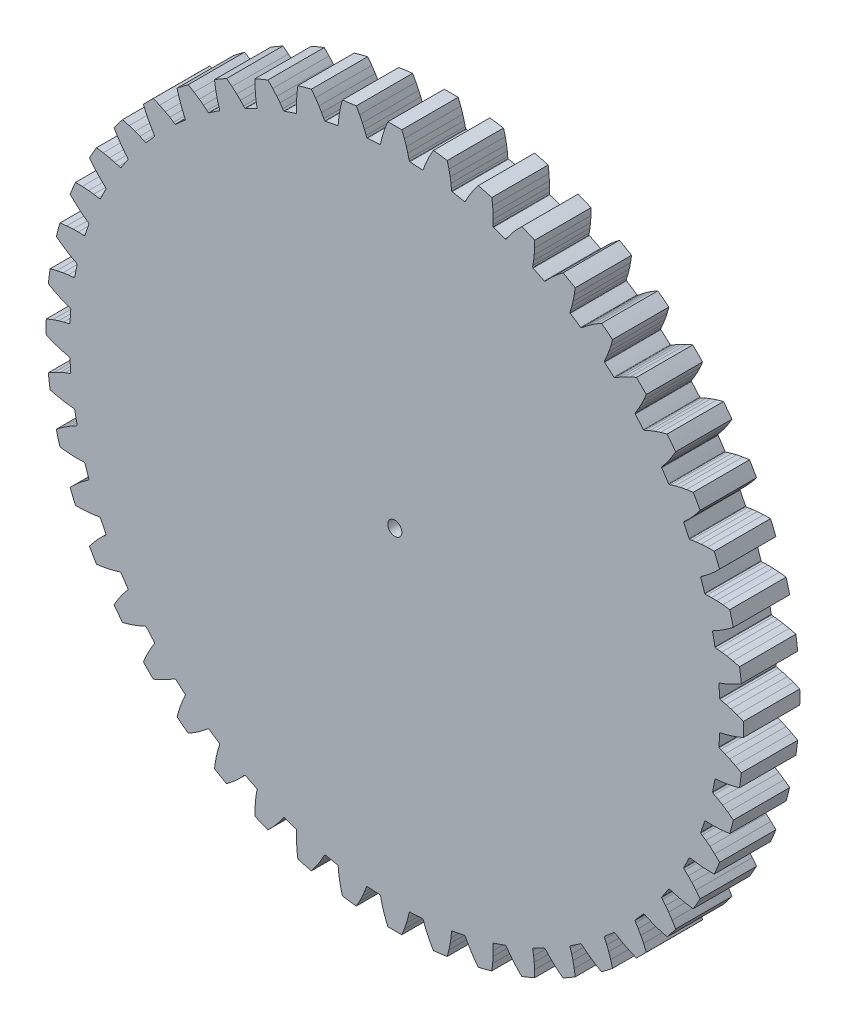
from build123d import *

# Parameters (mm, degrees)
BOSS_EXTRUDE1_DEPTH = 12.7
SKETCH2_R           = 1.5875
CUT_EXTRUDE1_DEPTH  = 112.886408538


with BuildPart() as part:
    # Model → Boss-Extrude1 (new body)
    with BuildSketch(Plane.XY):
        with BuildLine():
            ThreePointArc((73.162446932, -4.79532012), (73.204630323, -4.10132118), (73.240230779, -3.406953428))
            ThreePointArc((73.240230779, -3.406953428), (73.260031427, -3.342420246), (73.308462453, -3.295398625))
            ThreePointArc((73.308462453, -3.295398625), (73.487533932, -3.211262438), (73.677741354, -3.156795666))
            ThreePointArc((73.677741354, -3.156795666), (74.184998964, -3.047419574), (74.689081629, -2.92423646))
            ThreePointArc((74.689081629, -2.92423646), (75.251182782, -2.771398985), (75.809400918, -2.604937236))
            ThreePointArc((75.809400918, -2.604937236), (76.484121563, -2.384761597), (77.152671556, -2.14650508))
            ThreePointArc((77.152671556, -2.14650508), (77.874182007, -1.868186231), (78.588597242, -1.572129509))
            ThreePointArc((78.588597242, -1.572129509), (78.604320541, 0), (78.588597242, 1.572129509))
            ThreePointArc((78.588597242, 1.572129509), (77.874182033, 1.868186221), (77.152671609, 2.14650506))
            ThreePointArc((77.152671609, 2.14650506), (76.484121638, 2.384761571), (75.809401016, 2.604937206))
            ThreePointArc((75.809401016, 2.604937206), (75.251182893, 2.771398953), (74.689081753, 2.924236429))
            ThreePointArc((74.689081753, 2.924236429), (74.184999097, 3.047419543), (73.677741495, 3.156795638))
            ThreePointArc((73.677741495, 3.156795638), (73.48753402, 3.211262408), (73.308462484, 3.295398596))
            ThreePointArc((73.308462484, 3.295398596), (73.260031444, 3.342420218), (73.24023078, 3.406953405))
            ThreePointArc((73.24023078, 3.406953405), (73.162446933, 4.795320109), (73.058347109, 6.181961972))
            ThreePointArc((73.058347109, 6.181961972), (73.06955509, 6.248527566), (73.111434229, 6.301468429))
            ThreePointArc((73.111434229, 6.301468429), (73.277991751, 6.408258337), (73.459462581, 6.487086188))
            ThreePointArc((73.459462581, 6.487086188), (73.948104087, 6.661736958), (74.431795632, 6.849662213))
            ThreePointArc((74.431795632, 6.849662213), (74.969138639, 7.074561066), (75.500853523, 7.312460799))
            ThreePointArc((75.500853523, 7.312460799), (76.141063151, 7.618821522), (76.77279489, 7.942303006))
            ThreePointArc((76.77279489, 7.942303006), (77.451804819, 8.312416811), (78.121464977, 8.699190627))
            ThreePointArc((78.121464977, 8.699190627), (77.931849682, 10.259922652), (77.71105682, 11.816550073))
            ThreePointArc((77.71105682, 11.816550073), (76.964110376, 12.016824081), (76.212444676, 12.198585857))
            ThreePointArc((76.212444676, 12.198585857), (75.518515528, 12.347540768), (74.820828547, 12.477764056))
            ThreePointArc((74.820828547, 12.477764056), (74.245658439, 12.569939614), (73.668416858, 12.648100622))
            ThreePointArc((73.668416858, 12.648100622), (73.152568076, 12.704433898), (72.635373689, 12.746663862))
            ThreePointArc((72.635373689, 12.746663862), (72.439684125, 12.775837604), (72.251162595, 12.83588047))
            ThreePointArc((72.251162595, 12.83588047), (72.197008335, 12.876178295), (72.168953797, 12.937574888))
            ThreePointArc((72.168953797, 12.937574888), (71.910617183, 14.303911092), (71.626414865, 15.665102288))
            ThreePointArc((71.626414865, 15.665102288), (71.628838407, 15.73256134), (71.663449094, 15.790515611))
            ThreePointArc((71.663449094, 15.790515611), (71.814642814, 15.918132035), (71.984272037, 16.0199722))
            ThreePointArc((71.984272037, 16.0199722), (72.445936647, 16.256909323), (72.900960975, 16.506361267))
            ThreePointArc((72.900960975, 16.506361267), (73.404351747, 16.799473416), (73.900465591, 17.104740603))
            ThreePointArc((73.900465591, 17.104740603), (74.495210038, 17.492044493), (75.079314418, 17.895216086))
            ThreePointArc((75.079314418, 17.895216086), (75.704205778, 18.350792096), (76.317652787, 18.821665199))
            ThreePointArc((76.317652787, 18.821665199), (75.925943269, 20.344295183), (75.50385867, 21.858786189))
            ThreePointArc((75.50385867, 21.858786189), (74.737161453, 21.959850751), (73.968201684, 22.041945467))
            ThreePointArc((73.968201684, 22.041945467), (73.260766679, 22.099050119), (72.552050957, 22.137092904))
            ThreePointArc((72.552050957, 22.137092904), (71.969770185, 22.153405123), (71.387264927, 22.155552307))
            ThreePointArc((71.387264927, 22.155552307), (70.868476334, 22.144071867), (70.350194501, 22.118433134))
            ThreePointArc((70.350194501, 22.118433134), (70.15237115, 22.121814677), (69.957625281, 22.15673687))
            ThreePointArc((69.957625281, 22.15673687), (69.898674397, 22.189621393), (69.862846006, 22.246830877))
            ThreePointArc((69.862846006, 22.246830877), (69.428376836, 23.567758191), (68.968934805, 24.880208361))
            ThreePointArc((68.968934805, 24.880208361), (68.962532439, 24.947406627), (68.989282477, 25.009382692))
            ThreePointArc((68.989282477, 25.009382692), (69.122525427, 25.155642081), (69.27741064, 25.278752046))
            ThreePointArc((69.27741064, 25.278752046), (69.704199144, 25.573921462), (70.122770665, 25.880631904))
            ThreePointArc((70.122770665, 25.880631904), (70.583596046, 26.236942118), (71.035620203, 26.604353553))
            ThreePointArc((71.035620203, 26.604353553), (71.574723228, 27.065973732), (72.101206061, 27.541937057))
            ThreePointArc((72.101206061, 27.541937057), (72.661286786, 28.075180241), (73.208024398, 28.622095861))
            ThreePointArc((73.208024398, 28.622095861), (72.620922915, 30.080571183), (72.004768564, 31.527012414))
            ThreePointArc((72.004768564, 31.527012414), (71.231438976, 31.527138285), (70.458342254, 31.508161279))
            ThreePointArc((70.458342254, 31.508161279), (69.7495058, 31.472438595), (69.04188766, 31.417649954))
            ThreePointArc((69.04188766, 31.417649954), (68.462459208, 31.357819728), (67.8846571, 31.28391635))
            ThreePointArc((67.8846571, 31.28391635), (67.371805314, 31.204818627), (66.861303979, 31.111749883))
            ThreePointArc((66.861303979, 31.111749883), (66.664731655, 31.089281367), (66.467093604, 31.098485359))
            ThreePointArc((66.467093604, 31.098485359), (66.404354761, 31.123393916), (66.361365551, 31.175437421))
            ThreePointArc((66.361365551, 31.175437421), (65.758197711, 32.428354413), (65.131377147, 33.669607171))
            ThreePointArc((65.131377147, 33.669607171), (65.116258421, 33.73539487), (65.134690109, 33.800332302))
            ThreePointArc((65.134690109, 33.800332302), (65.247702466, 33.962732117), (65.385193539, 34.105005435))
            ThreePointArc((65.385193539, 34.105005435), (65.769803469, 34.453356715), (66.144760306, 34.812077753))
            ThreePointArc((66.144760306, 34.812077753), (66.555135447, 35.225489466), (66.955335659, 35.648758637))
            ThreePointArc((66.955335659, 35.648758637), (67.429573058, 36.176796657), (67.889426077, 36.717407849))
            ThreePointArc((67.889426077, 36.717407849), (68.375113032, 37.319194268), (68.845786414, 37.932794528))
            ThreePointArc((68.845786414, 37.932794528), (68.073338436, 39.302160271), (67.273656905, 40.655802714))
            ThreePointArc((67.273656905, 40.655802714), (66.506926829, 40.554987742), (65.742921053, 40.435263716))
            ThreePointArc((65.742921053, 40.435263716), (65.044811539, 40.307324922), (64.350398523, 40.160642303))
            ThreePointArc((64.350398523, 40.160642303), (63.783736574, 40.025693344), (63.220523969, 39.87700391))
            ThreePointArc((63.220523969, 39.87700391), (62.722384026, 39.731642289), (62.22839801, 39.572735965))
            ThreePointArc((62.22839801, 39.572735965), (62.036440119, 39.524801833), (61.839291526, 39.508130142))
            ThreePointArc((61.839291526, 39.508130142), (61.773838203, 39.52463654), (61.724423732, 39.570623588))
            ThreePointArc((61.724423732, 39.570623588), (60.962877593, 40.7340925), (60.179403569, 41.882909668))
            ThreePointArc((60.179403569, 41.882909668), (60.155827168, 41.946161154), (60.165625135, 42.012948855))
            ThreePointArc((60.165625135, 42.012948855), (60.256473226, 42.188710389), (60.37421765, 42.347712726))
            ThreePointArc((60.37421765, 42.347712726), (60.710068222, 42.743285482), (61.03499476, 43.1478793))
            ThreePointArc((61.03499476, 43.1478793), (61.387898028, 43.611318923), (61.729426758, 44.083203578))
            ThreePointArc((61.729426758, 44.083203578), (62.130684199, 44.668624561), (62.516039191, 45.264633613))
            ThreePointArc((62.516039191, 45.264633613), (62.919022137, 45.924666535), (63.305577938, 46.594452564))
            ThreePointArc((63.305577938, 46.594452564), (62.361000263, 47.851278499), (61.391474324, 49.088960959))
            ThreePointArc((61.391474324, 49.088960959), (60.644462725, 48.888930115), (59.902620245, 48.67050758))
            ThreePointArc((59.902620245, 48.67050758), (59.227182519, 48.452541743), (58.557856226, 48.216474928))
            ThreePointArc((58.557856226, 48.216474928), (58.013656522, 48.008716249), (57.474670145, 47.787784878))
            ThreePointArc((57.474670145, 47.787784878), (56.999765357, 47.578646535), (56.530746897, 47.356621563))
            ThreePointArc((56.530746897, 47.356621563), (56.346687892, 47.284041982), (56.153402025, 47.241779864))
            ThreePointArc((56.153402025, 47.241779864), (56.086354148, 47.249601675), (56.031359909, 47.288745415))
            ThreePointArc((56.031359909, 47.288745415), (55.124465736, 48.342858971), (54.197743711, 49.379583967))
            ThreePointArc((54.197743711, 49.379583967), (54.166113034, 49.43921699), (54.167109633, 49.506712205))
            ThreePointArc((54.167109633, 49.506712205), (54.234239023, 49.69282813), (54.330222157, 49.865838912))
            ThreePointArc((54.330222157, 49.865838912), (54.611566875, 50.301864784), (54.880903531, 50.745408669))
            ThreePointArc((54.880903531, 50.745408669), (55.170296653, 51.250946622), (55.447310251, 51.763372683))
            ThreePointArc((55.447310251, 51.763372683), (55.768722107, 52.396159914), (56.072985542, 53.037368946))
            ThreePointArc((56.072985542, 53.037368946), (56.386369329, 53.744355024), (56.682193471, 54.458866597))
            ThreePointArc((56.682193471, 54.458866597), (55.581648085, 55.581648085), (54.458866597, 56.682193471))
            ThreePointArc((54.458866597, 56.682193471), (53.74435505, 56.38636934), (53.037368997, 56.072985565))
            ThreePointArc((53.037368997, 56.072985565), (52.396159985, 55.768722142), (51.763372773, 55.447310299))
            ThreePointArc((51.763372773, 55.447310299), (51.250946723, 55.170296709), (50.74540878, 54.880903596))
            ThreePointArc((50.74540878, 54.880903596), (50.3018649, 54.611566948), (49.865839032, 54.330222236))
            ThreePointArc((49.865839032, 54.330222236), (49.692828213, 54.234239063), (49.506712247, 54.167109635))
            ThreePointArc((49.506712247, 54.167109635), (49.439217022, 54.166113025), (49.379583984, 54.197743696))
            ThreePointArc((49.379583984, 54.197743696), (48.342858988, 55.124465721), (47.288745432, 56.031359895))
            ThreePointArc((47.288745432, 56.031359895), (47.249601688, 56.086354117), (47.241779868, 56.153401983))
            ThreePointArc((47.241779868, 56.153401983), (47.284041953, 56.346687804), (47.3566215, 56.530746768))
            ThreePointArc((47.3566215, 56.530746768), (47.578646478, 56.999765233), (47.787784827, 57.474670027))
            ThreePointArc((47.787784827, 57.474670027), (48.008716207, 58.013656415), (48.216474893, 58.55785613))
            ThreePointArc((48.216474893, 58.55785613), (48.452541718, 59.227182444), (48.670507563, 59.902620192))
            ThreePointArc((48.670507563, 59.902620192), (48.888930108, 60.644462698), (49.088960959, 61.391474324))
            ThreePointArc((49.088960959, 61.391474324), (47.851278499, 62.361000263), (46.594452564, 63.305577938))
            ThreePointArc((46.594452564, 63.305577938), (45.924666559, 62.919022151), (45.264633661, 62.516039221))
            ThreePointArc((45.264633661, 62.516039221), (44.668624627, 62.130684243), (44.083203661, 61.729426817))
            ThreePointArc((44.083203661, 61.729426817), (43.611319016, 61.387898096), (43.147879401, 61.034994839))
            ThreePointArc((43.147879401, 61.034994839), (42.743285587, 60.710068309), (42.347712835, 60.374217744))
            ThreePointArc((42.347712835, 60.374217744), (42.188710466, 60.256473277), (42.012948897, 60.165625142))
            ThreePointArc((42.012948897, 60.165625142), (41.946161187, 60.155827164), (41.882909686, 60.179403556))
            ThreePointArc((41.882909686, 60.179403556), (40.734092519, 60.96287758), (39.570623607, 61.72442372))
            ThreePointArc((39.570623607, 61.72442372), (39.524636557, 61.773838175), (39.508130151, 61.839291485))
            ThreePointArc((39.508130151, 61.839291485), (39.524801816, 62.036440028), (39.572735919, 62.228397873))
            ThreePointArc((39.572735919, 62.228397873), (39.731642249, 62.722383896), (39.877003876, 63.220523846))
            ThreePointArc((39.877003876, 63.220523846), (40.025693316, 63.783736462), (40.160642281, 64.350398423))
            ThreePointArc((40.160642281, 64.350398423), (40.307324906, 65.044811462), (40.435263707, 65.742920997))
            ThreePointArc((40.435263707, 65.742920997), (40.554987738, 66.506926801), (40.655802714, 67.273656905))
            ThreePointArc((40.655802714, 67.273656905), (39.302160271, 68.073338436), (37.932794528, 68.845786414))
            ThreePointArc((37.932794528, 68.845786414), (37.31919429, 68.375113049), (36.717407893, 67.889426113))
            ThreePointArc((36.717407893, 67.889426113), (36.176796717, 67.42957311), (35.648758713, 66.955335728))
            ThreePointArc((35.648758713, 66.955335728), (35.225489549, 66.555135527), (34.812077843, 66.144760398))
            ThreePointArc((34.812077843, 66.144760398), (34.453356808, 65.769803569), (34.105005531, 65.385193648))
            ThreePointArc((34.105005531, 65.385193648), (33.962732186, 65.247702526), (33.800332343, 65.134690122))
            ThreePointArc((33.800332343, 65.134690122), (33.735394903, 65.116258421), (33.669607191, 65.131377137))
            ThreePointArc((33.669607191, 65.131377137), (32.428354433, 65.758197701), (31.175437442, 66.361365541))
            ThreePointArc((31.175437442, 66.361365541), (31.123393936, 66.404354734), (31.098485374, 66.467093564))
            ThreePointArc((31.098485374, 66.467093564), (31.089281362, 66.664731563), (31.111749855, 66.861303838))
            ThreePointArc((31.111749855, 66.861303838), (31.204818605, 67.37180518), (31.283916332, 67.884656973))
            ThreePointArc((31.283916332, 67.884656973), (31.357819715, 68.462459094), (31.417649945, 69.041887558))
            ThreePointArc((31.417649945, 69.041887558), (31.47243859, 69.749505721), (31.508161277, 70.458342198))
            ThreePointArc((31.508161277, 70.458342198), (31.527138285, 71.231438948), (31.527012414, 72.004768564))
            ThreePointArc((31.527012414, 72.004768564), (30.080571183, 72.620922915), (28.622095861, 73.208024398))
            ThreePointArc((28.622095861, 73.208024398), (28.075180261, 72.661286806), (27.541937096, 72.101206102))
            ThreePointArc((27.541937096, 72.101206102), (27.065973785, 71.574723287), (26.604353618, 71.035620282))
            ThreePointArc((26.604353618, 71.035620282), (26.23694219, 70.583596136), (25.880631981, 70.122770767))
            ThreePointArc((25.880631981, 70.122770767), (25.573921542, 69.704199255), (25.278752126, 69.277410759))
            ThreePointArc((25.278752126, 69.277410759), (25.155642143, 69.122525496), (25.009382731, 68.989282495))
            ThreePointArc((25.009382731, 68.989282495), (24.94740666, 68.962532443), (24.880208383, 68.968934797))
            ThreePointArc((24.880208383, 68.968934797), (23.567758212, 69.428376828), (22.246830898, 69.862846))
            ThreePointArc((22.246830898, 69.862846), (22.189621416, 69.898674374), (22.156736889, 69.957625244))
            ThreePointArc((22.156736889, 69.957625244), (22.121814683, 70.152371058), (22.118433125, 70.350194357))
            ThreePointArc((22.118433125, 70.350194357), (22.144071862, 70.868476198), (22.155552306, 71.387264799))
            ThreePointArc((22.155552306, 71.387264799), (22.153405125, 71.96977007), (22.137092908, 72.552050855))
            ThreePointArc((22.137092908, 72.552050855), (22.099050124, 73.2607666), (22.041945472, 73.968201628))
            ThreePointArc((22.041945472, 73.968201628), (21.959850754, 74.737161425), (21.858786189, 75.50385867))
            ThreePointArc((21.858786189, 75.50385867), (20.344295183, 75.925943269), (18.821665199, 76.317652787))
            ThreePointArc((18.821665199, 76.317652787), (18.350792113, 75.7042058), (17.895216119, 75.079314464))
            ThreePointArc((17.895216119, 75.079314464), (17.492044537, 74.495210104), (17.104740658, 73.900465677))
            ThreePointArc((17.104740658, 73.900465677), (16.799473475, 73.404351846), (16.50636133, 72.900961087))
            ThreePointArc((16.50636133, 72.900961087), (16.256909387, 72.445936767), (16.019972264, 71.984272166))
            ThreePointArc((16.019972264, 71.984272166), (15.918132087, 71.81464289), (15.790515647, 71.663449117))
            ThreePointArc((15.790515647, 71.663449117), (15.732561372, 71.628838415), (15.66510231, 71.626414861))
            ThreePointArc((15.66510231, 71.626414861), (14.303911114, 71.910617179), (12.93757491, 72.168953793))
            ThreePointArc((12.93757491, 72.168953793), (12.876178322, 72.197008315), (12.835880494, 72.25116256))
            ThreePointArc((12.835880494, 72.25116256), (12.775837623, 72.439684034), (12.746663872, 72.635373545))
            ThreePointArc((12.746663872, 72.635373545), (12.704433911, 73.152567941), (12.648100638, 73.668416731))
            ThreePointArc((12.648100638, 73.668416731), (12.569939631, 74.245658325), (12.477764073, 74.820828446))
            ThreePointArc((12.477764073, 74.820828446), (12.347540784, 75.51851545), (12.198585869, 76.212444621))
            ThreePointArc((12.198585869, 76.212444621), (12.016824088, 76.964110349), (11.816550073, 77.71105682))
            ThreePointArc((11.816550073, 77.71105682), (10.259922652, 77.931849682), (8.699190627, 78.121464977))
            ThreePointArc((8.699190627, 78.121464977), (8.312416824, 77.451804844), (7.942303033, 76.77279494))
            ThreePointArc((7.942303033, 76.77279494), (7.618821558, 76.141063222), (7.312460842, 75.500853616))
            ThreePointArc((7.312460842, 75.500853616), (7.074561112, 74.969138744), (6.849662261, 74.431795751))
            ThreePointArc((6.849662261, 74.431795751), (6.661737006, 73.948104214), (6.487086235, 73.459462718))
            ThreePointArc((6.487086235, 73.459462718), (6.408258378, 73.277991833), (6.301468462, 73.111434256))
            ThreePointArc((6.301468462, 73.111434256), (6.248527597, 73.069555103), (6.181961994, 73.058347108))
            ThreePointArc((6.181961994, 73.058347108), (4.795320131, 73.162446932), (3.406953428, 73.240230779))
            ThreePointArc((3.406953428, 73.240230779), (3.342420246, 73.260031427), (3.295398625, 73.308462453))
            ThreePointArc((3.295398625, 73.308462453), (3.211262438, 73.487533932), (3.156795666, 73.677741354))
            ThreePointArc((3.156795666, 73.677741354), (3.047419574, 74.184998964), (2.92423646, 74.689081629))
            ThreePointArc((2.92423646, 74.689081629), (2.771398985, 75.251182782), (2.604937236, 75.809400918))
            ThreePointArc((2.604937236, 75.809400918), (2.384761597, 76.484121563), (2.14650508, 77.152671556))
            ThreePointArc((2.14650508, 77.152671556), (1.868186231, 77.874182007), (1.572129509, 78.588597242))
            ThreePointArc((1.572129509, 78.588597242), (0, 78.604320541), (-1.572129509, 78.588597242))
            ThreePointArc((-1.572129509, 78.588597242), (-1.868186221, 77.874182033), (-2.14650506, 77.152671609))
            ThreePointArc((-2.14650506, 77.152671609), (-2.384761571, 76.484121638), (-2.604937206, 75.809401016))
            ThreePointArc((-2.604937206, 75.809401016), (-2.771398953, 75.251182893), (-2.924236429, 74.689081753))
            ThreePointArc((-2.924236429, 74.689081753), (-3.047419543, 74.184999097), (-3.156795638, 73.677741495))
            ThreePointArc((-3.156795638, 73.677741495), (-3.211262408, 73.48753402), (-3.295398596, 73.308462484))
            ThreePointArc((-3.295398596, 73.308462484), (-3.342420218, 73.260031444), (-3.406953405, 73.24023078))
            ThreePointArc((-3.406953405, 73.24023078), (-4.795320109, 73.162446933), (-6.181961972, 73.058347109))
            ThreePointArc((-6.181961972, 73.058347109), (-6.248527566, 73.06955509), (-6.301468429, 73.111434229))
            ThreePointArc((-6.301468429, 73.111434229), (-6.408258337, 73.277991751), (-6.487086188, 73.459462581))
            ThreePointArc((-6.487086188, 73.459462581), (-6.661736958, 73.948104087), (-6.849662213, 74.431795632))
            ThreePointArc((-6.849662213, 74.431795632), (-7.074561066, 74.969138639), (-7.312460799, 75.500853523))
            ThreePointArc((-7.312460799, 75.500853523), (-7.618821522, 76.141063151), (-7.942303006, 76.77279489))
            ThreePointArc((-7.942303006, 76.77279489), (-8.312416811, 77.451804819), (-8.699190627, 78.121464977))
            ThreePointArc((-8.699190627, 78.121464977), (-10.259922652, 77.931849682), (-11.816550073, 77.71105682))
            ThreePointArc((-11.816550073, 77.71105682), (-12.016824081, 76.964110376), (-12.198585857, 76.212444676))
            ThreePointArc((-12.198585857, 76.212444676), (-12.347540768, 75.518515528), (-12.477764056, 74.820828547))
            ThreePointArc((-12.477764056, 74.820828547), (-12.569939614, 74.245658439), (-12.648100622, 73.668416858))
            ThreePointArc((-12.648100622, 73.668416858), (-12.704433898, 73.152568076), (-12.746663862, 72.635373689))
            ThreePointArc((-12.746663862, 72.635373689), (-12.775837604, 72.439684125), (-12.83588047, 72.251162595))
            ThreePointArc((-12.83588047, 72.251162595), (-12.876178295, 72.197008335), (-12.937574888, 72.168953797))
            ThreePointArc((-12.937574888, 72.168953797), (-14.303911092, 71.910617183), (-15.665102288, 71.626414865))
            ThreePointArc((-15.665102288, 71.626414865), (-15.73256134, 71.628838407), (-15.790515611, 71.663449094))
            ThreePointArc((-15.790515611, 71.663449094), (-15.918132035, 71.814642814), (-16.0199722, 71.984272037))
            ThreePointArc((-16.0199722, 71.984272037), (-16.256909323, 72.445936647), (-16.506361267, 72.900960975))
            ThreePointArc((-16.506361267, 72.900960975), (-16.799473416, 73.404351747), (-17.104740603, 73.900465591))
            ThreePointArc((-17.104740603, 73.900465591), (-17.492044493, 74.495210038), (-17.895216086, 75.079314418))
            ThreePointArc((-17.895216086, 75.079314418), (-18.350792096, 75.704205778), (-18.821665199, 76.317652787))
            ThreePointArc((-18.821665199, 76.317652787), (-20.344295183, 75.925943269), (-21.858786189, 75.50385867))
            ThreePointArc((-21.858786189, 75.50385867), (-21.959850751, 74.737161453), (-22.041945467, 73.968201684))
            ThreePointArc((-22.041945467, 73.968201684), (-22.099050119, 73.260766679), (-22.137092904, 72.552050957))
            ThreePointArc((-22.137092904, 72.552050957), (-22.153405123, 71.969770185), (-22.155552307, 71.387264927))
            ThreePointArc((-22.155552307, 71.387264927), (-22.144071867, 70.868476334), (-22.118433134, 70.350194501))
            ThreePointArc((-22.118433134, 70.350194501), (-22.121814677, 70.15237115), (-22.15673687, 69.957625281))
            ThreePointArc((-22.15673687, 69.957625281), (-22.189621393, 69.898674397), (-22.246830877, 69.862846006))
            ThreePointArc((-22.246830877, 69.862846006), (-23.567758191, 69.428376836), (-24.880208361, 68.968934805))
            ThreePointArc((-24.880208361, 68.968934805), (-24.947406627, 68.962532439), (-25.009382692, 68.989282477))
            ThreePointArc((-25.009382692, 68.989282477), (-25.155642081, 69.122525427), (-25.278752046, 69.27741064))
            ThreePointArc((-25.278752046, 69.27741064), (-25.573921462, 69.704199144), (-25.880631904, 70.122770665))
            ThreePointArc((-25.880631904, 70.122770665), (-26.236942118, 70.583596046), (-26.604353553, 71.035620203))
            ThreePointArc((-26.604353553, 71.035620203), (-27.065973732, 71.574723228), (-27.541937057, 72.101206061))
            ThreePointArc((-27.541937057, 72.101206061), (-28.075180241, 72.661286786), (-28.622095861, 73.208024398))
            ThreePointArc((-28.622095861, 73.208024398), (-30.080571183, 72.620922915), (-31.527012414, 72.004768564))
            ThreePointArc((-31.527012414, 72.004768564), (-31.527138285, 71.231438976), (-31.508161279, 70.458342254))
            ThreePointArc((-31.508161279, 70.458342254), (-31.472438595, 69.7495058), (-31.417649954, 69.04188766))
            ThreePointArc((-31.417649954, 69.04188766), (-31.357819728, 68.462459208), (-31.28391635, 67.8846571))
            ThreePointArc((-31.28391635, 67.8846571), (-31.204818627, 67.371805314), (-31.111749883, 66.861303979))
            ThreePointArc((-31.111749883, 66.861303979), (-31.089281367, 66.664731655), (-31.098485359, 66.467093604))
            ThreePointArc((-31.098485359, 66.467093604), (-31.123393916, 66.404354761), (-31.175437421, 66.361365551))
            ThreePointArc((-31.175437421, 66.361365551), (-32.428354413, 65.758197711), (-33.669607171, 65.131377147))
            ThreePointArc((-33.669607171, 65.131377147), (-33.73539487, 65.116258421), (-33.800332302, 65.134690109))
            ThreePointArc((-33.800332302, 65.134690109), (-33.962732117, 65.247702466), (-34.105005435, 65.385193539))
            ThreePointArc((-34.105005435, 65.385193539), (-34.453356715, 65.769803469), (-34.812077753, 66.144760306))
            ThreePointArc((-34.812077753, 66.144760306), (-35.225489466, 66.555135447), (-35.648758637, 66.955335659))
            ThreePointArc((-35.648758637, 66.955335659), (-36.176796657, 67.429573058), (-36.717407849, 67.889426077))
            ThreePointArc((-36.717407849, 67.889426077), (-37.319194268, 68.375113032), (-37.932794528, 68.845786414))
            ThreePointArc((-37.932794528, 68.845786414), (-39.302160271, 68.073338436), (-40.655802714, 67.273656905))
            ThreePointArc((-40.655802714, 67.273656905), (-40.554987742, 66.506926829), (-40.435263716, 65.742921053))
            ThreePointArc((-40.435263716, 65.742921053), (-40.307324922, 65.044811539), (-40.160642303, 64.350398523))
            ThreePointArc((-40.160642303, 64.350398523), (-40.025693344, 63.783736574), (-39.87700391, 63.220523969))
            ThreePointArc((-39.87700391, 63.220523969), (-39.731642289, 62.722384026), (-39.572735965, 62.22839801))
            ThreePointArc((-39.572735965, 62.22839801), (-39.524801833, 62.036440119), (-39.508130142, 61.839291526))
            ThreePointArc((-39.508130142, 61.839291526), (-39.52463654, 61.773838203), (-39.570623588, 61.724423732))
            ThreePointArc((-39.570623588, 61.724423732), (-40.7340925, 60.962877593), (-41.882909668, 60.179403569))
            ThreePointArc((-41.882909668, 60.179403569), (-41.946161154, 60.155827168), (-42.012948855, 60.165625135))
            ThreePointArc((-42.012948855, 60.165625135), (-42.188710389, 60.256473226), (-42.347712726, 60.37421765))
            ThreePointArc((-42.347712726, 60.37421765), (-42.743285482, 60.710068222), (-43.1478793, 61.03499476))
            ThreePointArc((-43.1478793, 61.03499476), (-43.611318923, 61.387898028), (-44.083203578, 61.729426758))
            ThreePointArc((-44.083203578, 61.729426758), (-44.668624561, 62.130684199), (-45.264633613, 62.516039191))
            ThreePointArc((-45.264633613, 62.516039191), (-45.924666535, 62.919022137), (-46.594452564, 63.305577938))
            ThreePointArc((-46.594452564, 63.305577938), (-47.851278499, 62.361000263), (-49.088960959, 61.391474324))
            ThreePointArc((-49.088960959, 61.391474324), (-48.888930115, 60.644462725), (-48.67050758, 59.902620245))
            ThreePointArc((-48.67050758, 59.902620245), (-48.452541743, 59.227182519), (-48.216474928, 58.557856226))
            ThreePointArc((-48.216474928, 58.557856226), (-48.008716249, 58.013656522), (-47.787784878, 57.474670145))
            ThreePointArc((-47.787784878, 57.474670145), (-47.578646535, 56.999765357), (-47.356621563, 56.530746897))
            ThreePointArc((-47.356621563, 56.530746897), (-47.284041982, 56.346687892), (-47.241779864, 56.153402025))
            ThreePointArc((-47.241779864, 56.153402025), (-47.249601675, 56.086354148), (-47.288745415, 56.031359909))
            ThreePointArc((-47.288745415, 56.031359909), (-48.342858971, 55.124465736), (-49.379583967, 54.197743711))
            ThreePointArc((-49.379583967, 54.197743711), (-49.43921699, 54.166113034), (-49.506712205, 54.167109633))
            ThreePointArc((-49.506712205, 54.167109633), (-49.69282813, 54.234239023), (-49.865838912, 54.330222157))
            ThreePointArc((-49.865838912, 54.330222157), (-50.301864784, 54.611566875), (-50.745408669, 54.880903531))
            ThreePointArc((-50.745408669, 54.880903531), (-51.250946622, 55.170296653), (-51.763372683, 55.447310251))
            ThreePointArc((-51.763372683, 55.447310251), (-52.396159914, 55.768722107), (-53.037368946, 56.072985542))
            ThreePointArc((-53.037368946, 56.072985542), (-53.744355024, 56.386369329), (-54.458866597, 56.682193471))
            ThreePointArc((-54.458866597, 56.682193471), (-55.581648085, 55.581648085), (-56.682193471, 54.458866597))
            ThreePointArc((-56.682193471, 54.458866597), (-56.38636934, 53.74435505), (-56.072985565, 53.037368997))
            ThreePointArc((-56.072985565, 53.037368997), (-55.768722142, 52.396159985), (-55.447310299, 51.763372773))
            ThreePointArc((-55.447310299, 51.763372773), (-55.170296709, 51.250946723), (-54.880903596, 50.74540878))
            ThreePointArc((-54.880903596, 50.74540878), (-54.611566948, 50.3018649), (-54.330222236, 49.865839032))
            ThreePointArc((-54.330222236, 49.865839032), (-54.234239063, 49.692828213), (-54.167109635, 49.506712247))
            ThreePointArc((-54.167109635, 49.506712247), (-54.166113025, 49.439217022), (-54.197743696, 49.379583984))
            ThreePointArc((-54.197743696, 49.379583984), (-55.124465721, 48.342858988), (-56.031359895, 47.288745432))
            ThreePointArc((-56.031359895, 47.288745432), (-56.086354117, 47.249601688), (-56.153401983, 47.241779868))
            ThreePointArc((-56.153401983, 47.241779868), (-56.346687804, 47.284041953), (-56.530746768, 47.3566215))
            ThreePointArc((-56.530746768, 47.3566215), (-56.999765233, 47.578646478), (-57.474670027, 47.787784827))
            ThreePointArc((-57.474670027, 47.787784827), (-58.013656415, 48.008716207), (-58.55785613, 48.216474893))
            ThreePointArc((-58.55785613, 48.216474893), (-59.227182444, 48.452541718), (-59.902620192, 48.670507563))
            ThreePointArc((-59.902620192, 48.670507563), (-60.644462698, 48.888930108), (-61.391474324, 49.088960959))
            ThreePointArc((-61.391474324, 49.088960959), (-62.361000263, 47.851278499), (-63.305577938, 46.594452564))
            ThreePointArc((-63.305577938, 46.594452564), (-62.919022151, 45.924666559), (-62.516039221, 45.264633661))
            ThreePointArc((-62.516039221, 45.264633661), (-62.130684243, 44.668624627), (-61.729426817, 44.083203661))
            ThreePointArc((-61.729426817, 44.083203661), (-61.387898096, 43.611319016), (-61.034994839, 43.147879401))
            ThreePointArc((-61.034994839, 43.147879401), (-60.710068309, 42.743285587), (-60.374217744, 42.347712835))
            ThreePointArc((-60.374217744, 42.347712835), (-60.256473277, 42.188710466), (-60.165625142, 42.012948897))
            ThreePointArc((-60.165625142, 42.012948897), (-60.155827164, 41.946161187), (-60.179403556, 41.882909686))
            ThreePointArc((-60.179403556, 41.882909686), (-60.96287758, 40.734092519), (-61.72442372, 39.570623607))
            ThreePointArc((-61.72442372, 39.570623607), (-61.773838175, 39.524636557), (-61.839291485, 39.508130151))
            ThreePointArc((-61.839291485, 39.508130151), (-62.036440028, 39.524801816), (-62.228397873, 39.572735919))
            ThreePointArc((-62.228397873, 39.572735919), (-62.722383896, 39.731642249), (-63.220523846, 39.877003876))
            ThreePointArc((-63.220523846, 39.877003876), (-63.783736462, 40.025693316), (-64.350398423, 40.160642281))
            ThreePointArc((-64.350398423, 40.160642281), (-65.044811462, 40.307324906), (-65.742920997, 40.435263707))
            ThreePointArc((-65.742920997, 40.435263707), (-66.506926801, 40.554987738), (-67.273656905, 40.655802714))
            ThreePointArc((-67.273656905, 40.655802714), (-68.073338436, 39.302160271), (-68.845786414, 37.932794528))
            ThreePointArc((-68.845786414, 37.932794528), (-68.375113049, 37.31919429), (-67.889426113, 36.717407893))
            ThreePointArc((-67.889426113, 36.717407893), (-67.42957311, 36.176796717), (-66.955335728, 35.648758713))
            ThreePointArc((-66.955335728, 35.648758713), (-66.555135527, 35.225489549), (-66.144760398, 34.812077843))
            ThreePointArc((-66.144760398, 34.812077843), (-65.769803569, 34.453356808), (-65.385193648, 34.105005531))
            ThreePointArc((-65.385193648, 34.105005531), (-65.247702526, 33.962732186), (-65.134690122, 33.800332343))
            ThreePointArc((-65.134690122, 33.800332343), (-65.116258421, 33.735394903), (-65.131377137, 33.669607191))
            ThreePointArc((-65.131377137, 33.669607191), (-65.758197701, 32.428354433), (-66.361365541, 31.175437442))
            ThreePointArc((-66.361365541, 31.175437442), (-66.404354734, 31.123393936), (-66.467093564, 31.098485374))
            ThreePointArc((-66.467093564, 31.098485374), (-66.664731563, 31.089281362), (-66.861303838, 31.111749855))
            ThreePointArc((-66.861303838, 31.111749855), (-67.37180518, 31.204818605), (-67.884656973, 31.283916332))
            ThreePointArc((-67.884656973, 31.283916332), (-68.462459094, 31.357819715), (-69.041887558, 31.417649945))
            ThreePointArc((-69.041887558, 31.417649945), (-69.749505721, 31.47243859), (-70.458342198, 31.508161277))
            ThreePointArc((-70.458342198, 31.508161277), (-71.231438948, 31.527138285), (-72.004768564, 31.527012414))
            ThreePointArc((-72.004768564, 31.527012414), (-72.620922915, 30.080571183), (-73.208024398, 28.622095861))
            ThreePointArc((-73.208024398, 28.622095861), (-72.661286806, 28.075180261), (-72.101206102, 27.541937096))
            ThreePointArc((-72.101206102, 27.541937096), (-71.574723287, 27.065973785), (-71.035620282, 26.604353618))
            ThreePointArc((-71.035620282, 26.604353618), (-70.583596136, 26.23694219), (-70.122770767, 25.880631981))
            ThreePointArc((-70.122770767, 25.880631981), (-69.704199255, 25.573921542), (-69.277410759, 25.278752126))
            ThreePointArc((-69.277410759, 25.278752126), (-69.122525496, 25.155642143), (-68.989282495, 25.009382731))
            ThreePointArc((-68.989282495, 25.009382731), (-68.962532443, 24.94740666), (-68.968934797, 24.880208383))
            ThreePointArc((-68.968934797, 24.880208383), (-69.428376828, 23.567758212), (-69.862846, 22.246830898))
            ThreePointArc((-69.862846, 22.246830898), (-69.898674374, 22.189621416), (-69.957625244, 22.156736889))
            ThreePointArc((-69.957625244, 22.156736889), (-70.152371058, 22.121814683), (-70.350194357, 22.118433125))
            ThreePointArc((-70.350194357, 22.118433125), (-70.868476198, 22.144071862), (-71.387264799, 22.155552306))
            ThreePointArc((-71.387264799, 22.155552306), (-71.96977007, 22.153405125), (-72.552050855, 22.137092908))
            ThreePointArc((-72.552050855, 22.137092908), (-73.2607666, 22.099050124), (-73.968201628, 22.041945472))
            ThreePointArc((-73.968201628, 22.041945472), (-74.737161425, 21.959850754), (-75.50385867, 21.858786189))
            ThreePointArc((-75.50385867, 21.858786189), (-75.925943269, 20.344295183), (-76.317652787, 18.821665199))
            ThreePointArc((-76.317652787, 18.821665199), (-75.7042058, 18.350792113), (-75.079314464, 17.895216119))
            ThreePointArc((-75.079314464, 17.895216119), (-74.495210104, 17.492044537), (-73.900465677, 17.104740658))
            ThreePointArc((-73.900465677, 17.104740658), (-73.404351846, 16.799473475), (-72.900961087, 16.50636133))
            ThreePointArc((-72.900961087, 16.50636133), (-72.445936767, 16.256909387), (-71.984272166, 16.019972264))
            ThreePointArc((-71.984272166, 16.019972264), (-71.81464289, 15.918132087), (-71.663449117, 15.790515647))
            ThreePointArc((-71.663449117, 15.790515647), (-71.628838415, 15.732561372), (-71.626414861, 15.66510231))
            ThreePointArc((-71.626414861, 15.66510231), (-71.910617179, 14.303911114), (-72.168953793, 12.93757491))
            ThreePointArc((-72.168953793, 12.93757491), (-72.197008315, 12.876178322), (-72.25116256, 12.835880494))
            ThreePointArc((-72.25116256, 12.835880494), (-72.439684034, 12.775837623), (-72.635373545, 12.746663872))
            ThreePointArc((-72.635373545, 12.746663872), (-73.152567941, 12.704433911), (-73.668416731, 12.648100638))
            ThreePointArc((-73.668416731, 12.648100638), (-74.245658325, 12.569939631), (-74.820828446, 12.477764073))
            ThreePointArc((-74.820828446, 12.477764073), (-75.51851545, 12.347540784), (-76.212444621, 12.198585869))
            ThreePointArc((-76.212444621, 12.198585869), (-76.964110349, 12.016824088), (-77.71105682, 11.816550073))
            ThreePointArc((-77.71105682, 11.816550073), (-77.931849682, 10.259922652), (-78.121464977, 8.699190627))
            ThreePointArc((-78.121464977, 8.699190627), (-77.451804844, 8.312416824), (-76.77279494, 7.942303033))
            ThreePointArc((-76.77279494, 7.942303033), (-76.141063222, 7.618821558), (-75.500853616, 7.312460842))
            ThreePointArc((-75.500853616, 7.312460842), (-74.969138744, 7.074561112), (-74.431795751, 6.849662261))
            ThreePointArc((-74.431795751, 6.849662261), (-73.948104214, 6.661737006), (-73.459462718, 6.487086235))
            ThreePointArc((-73.459462718, 6.487086235), (-73.277991833, 6.408258378), (-73.111434256, 6.301468462))
            ThreePointArc((-73.111434256, 6.301468462), (-73.069555103, 6.248527597), (-73.058347108, 6.181961994))
            ThreePointArc((-73.058347108, 6.181961994), (-73.162446932, 4.795320131), (-73.240230779, 3.406953428))
            ThreePointArc((-73.240230779, 3.406953428), (-73.260031427, 3.342420246), (-73.308462453, 3.295398625))
            ThreePointArc((-73.308462453, 3.295398625), (-73.487533932, 3.211262438), (-73.677741354, 3.156795666))
            ThreePointArc((-73.677741354, 3.156795666), (-74.184998964, 3.047419574), (-74.689081629, 2.92423646))
            ThreePointArc((-74.689081629, 2.92423646), (-75.251182782, 2.771398985), (-75.809400918, 2.604937236))
            ThreePointArc((-75.809400918, 2.604937236), (-76.484121563, 2.384761597), (-77.152671556, 2.14650508))
            ThreePointArc((-77.152671556, 2.14650508), (-77.874182007, 1.868186231), (-78.588597242, 1.572129509))
            ThreePointArc((-78.588597242, 1.572129509), (-78.604320541, 0), (-78.588597242, -1.572129509))
            ThreePointArc((-78.588597242, -1.572129509), (-77.874182033, -1.868186221), (-77.152671609, -2.14650506))
            ThreePointArc((-77.152671609, -2.14650506), (-76.484121638, -2.384761571), (-75.809401016, -2.604937206))
            ThreePointArc((-75.809401016, -2.604937206), (-75.251182893, -2.771398953), (-74.689081753, -2.924236429))
            ThreePointArc((-74.689081753, -2.924236429), (-74.184999097, -3.047419543), (-73.677741495, -3.156795638))
            ThreePointArc((-73.677741495, -3.156795638), (-73.48753402, -3.211262408), (-73.308462484, -3.295398596))
            ThreePointArc((-73.308462484, -3.295398596), (-73.260031444, -3.342420218), (-73.24023078, -3.406953405))
            ThreePointArc((-73.24023078, -3.406953405), (-73.162446933, -4.795320109), (-73.058347109, -6.181961972))
            ThreePointArc((-73.058347109, -6.181961972), (-73.06955509, -6.248527566), (-73.111434229, -6.301468429))
            ThreePointArc((-73.111434229, -6.301468429), (-73.277991751, -6.408258337), (-73.459462581, -6.487086188))
            ThreePointArc((-73.459462581, -6.487086188), (-73.948104087, -6.661736958), (-74.431795632, -6.849662213))
            ThreePointArc((-74.431795632, -6.849662213), (-74.969138639, -7.074561066), (-75.500853523, -7.312460799))
            ThreePointArc((-75.500853523, -7.312460799), (-76.141063151, -7.618821522), (-76.77279489, -7.942303006))
            ThreePointArc((-76.77279489, -7.942303006), (-77.451804819, -8.312416811), (-78.121464977, -8.699190627))
            ThreePointArc((-78.121464977, -8.699190627), (-77.931849682, -10.259922652), (-77.71105682, -11.816550073))
            ThreePointArc((-77.71105682, -11.816550073), (-76.964110376, -12.016824081), (-76.212444676, -12.198585857))
            ThreePointArc((-76.212444676, -12.198585857), (-75.518515528, -12.347540768), (-74.820828547, -12.477764056))
            ThreePointArc((-74.820828547, -12.477764056), (-74.245658439, -12.569939614), (-73.668416858, -12.648100622))
            ThreePointArc((-73.668416858, -12.648100622), (-73.152568076, -12.704433898), (-72.635373689, -12.746663862))
            ThreePointArc((-72.635373689, -12.746663862), (-72.439684125, -12.775837604), (-72.251162595, -12.83588047))
            ThreePointArc((-72.251162595, -12.83588047), (-72.197008335, -12.876178295), (-72.168953797, -12.937574888))
            ThreePointArc((-72.168953797, -12.937574888), (-71.910617183, -14.303911092), (-71.626414865, -15.665102288))
            ThreePointArc((-71.626414865, -15.665102288), (-71.628838407, -15.73256134), (-71.663449094, -15.790515611))
            ThreePointArc((-71.663449094, -15.790515611), (-71.814642814, -15.918132035), (-71.984272037, -16.0199722))
            ThreePointArc((-71.984272037, -16.0199722), (-72.445936647, -16.256909323), (-72.900960975, -16.506361267))
            ThreePointArc((-72.900960975, -16.506361267), (-73.404351747, -16.799473416), (-73.900465591, -17.104740603))
            ThreePointArc((-73.900465591, -17.104740603), (-74.495210038, -17.492044493), (-75.079314418, -17.895216086))
            ThreePointArc((-75.079314418, -17.895216086), (-75.704205778, -18.350792096), (-76.317652787, -18.821665199))
            ThreePointArc((-76.317652787, -18.821665199), (-75.925943269, -20.344295183), (-75.50385867, -21.858786189))
            ThreePointArc((-75.50385867, -21.858786189), (-74.737161453, -21.959850751), (-73.968201684, -22.041945467))
            ThreePointArc((-73.968201684, -22.041945467), (-73.260766679, -22.099050119), (-72.552050957, -22.137092904))
            ThreePointArc((-72.552050957, -22.137092904), (-71.969770185, -22.153405123), (-71.387264927, -22.155552307))
            ThreePointArc((-71.387264927, -22.155552307), (-70.868476334, -22.144071867), (-70.350194501, -22.118433134))
            ThreePointArc((-70.350194501, -22.118433134), (-70.15237115, -22.121814677), (-69.957625281, -22.15673687))
            ThreePointArc((-69.957625281, -22.15673687), (-69.898674397, -22.189621393), (-69.862846006, -22.246830877))
            ThreePointArc((-69.862846006, -22.246830877), (-69.428376836, -23.567758191), (-68.968934805, -24.880208361))
            ThreePointArc((-68.968934805, -24.880208361), (-68.962532439, -24.947406627), (-68.989282477, -25.009382692))
            ThreePointArc((-68.989282477, -25.009382692), (-69.122525427, -25.155642081), (-69.27741064, -25.278752046))
            ThreePointArc((-69.27741064, -25.278752046), (-69.704199144, -25.573921462), (-70.122770665, -25.880631904))
            ThreePointArc((-70.122770665, -25.880631904), (-70.583596046, -26.236942118), (-71.035620203, -26.604353553))
            ThreePointArc((-71.035620203, -26.604353553), (-71.574723228, -27.065973732), (-72.101206061, -27.541937057))
            ThreePointArc((-72.101206061, -27.541937057), (-72.661286786, -28.075180241), (-73.208024398, -28.622095861))
            ThreePointArc((-73.208024398, -28.622095861), (-72.620922915, -30.080571183), (-72.004768564, -31.527012414))
            ThreePointArc((-72.004768564, -31.527012414), (-71.231438976, -31.527138285), (-70.458342254, -31.508161279))
            ThreePointArc((-70.458342254, -31.508161279), (-69.7495058, -31.472438595), (-69.04188766, -31.417649954))
            ThreePointArc((-69.04188766, -31.417649954), (-68.462459208, -31.357819728), (-67.8846571, -31.28391635))
            ThreePointArc((-67.8846571, -31.28391635), (-67.371805314, -31.204818627), (-66.861303979, -31.111749883))
            ThreePointArc((-66.861303979, -31.111749883), (-66.664731655, -31.089281367), (-66.467093604, -31.098485359))
            ThreePointArc((-66.467093604, -31.098485359), (-66.404354761, -31.123393916), (-66.361365551, -31.175437421))
            ThreePointArc((-66.361365551, -31.175437421), (-65.758197711, -32.428354413), (-65.131377147, -33.669607171))
            ThreePointArc((-65.131377147, -33.669607171), (-65.116258421, -33.73539487), (-65.134690109, -33.800332302))
            ThreePointArc((-65.134690109, -33.800332302), (-65.247702466, -33.962732117), (-65.385193539, -34.105005435))
            ThreePointArc((-65.385193539, -34.105005435), (-65.769803469, -34.453356715), (-66.144760306, -34.812077753))
            ThreePointArc((-66.144760306, -34.812077753), (-66.555135447, -35.225489466), (-66.955335659, -35.648758637))
            ThreePointArc((-66.955335659, -35.648758637), (-67.429573058, -36.176796657), (-67.889426077, -36.717407849))
            ThreePointArc((-67.889426077, -36.717407849), (-68.375113032, -37.319194268), (-68.845786414, -37.932794528))
            ThreePointArc((-68.845786414, -37.932794528), (-68.073338436, -39.302160271), (-67.273656905, -40.655802714))
            ThreePointArc((-67.273656905, -40.655802714), (-66.506926829, -40.554987742), (-65.742921053, -40.435263716))
            ThreePointArc((-65.742921053, -40.435263716), (-65.044811539, -40.307324922), (-64.350398523, -40.160642303))
            ThreePointArc((-64.350398523, -40.160642303), (-63.783736574, -40.025693344), (-63.220523969, -39.87700391))
            ThreePointArc((-63.220523969, -39.87700391), (-62.722384026, -39.731642289), (-62.22839801, -39.572735965))
            ThreePointArc((-62.22839801, -39.572735965), (-62.036440119, -39.524801833), (-61.839291526, -39.508130142))
            ThreePointArc((-61.839291526, -39.508130142), (-61.773838203, -39.52463654), (-61.724423732, -39.570623588))
            ThreePointArc((-61.724423732, -39.570623588), (-60.962877593, -40.7340925), (-60.179403569, -41.882909668))
            ThreePointArc((-60.179403569, -41.882909668), (-60.155827168, -41.946161154), (-60.165625135, -42.012948855))
            ThreePointArc((-60.165625135, -42.012948855), (-60.256473226, -42.188710389), (-60.37421765, -42.347712726))
            ThreePointArc((-60.37421765, -42.347712726), (-60.710068222, -42.743285482), (-61.03499476, -43.1478793))
            ThreePointArc((-61.03499476, -43.1478793), (-61.387898028, -43.611318923), (-61.729426758, -44.083203578))
            ThreePointArc((-61.729426758, -44.083203578), (-62.130684199, -44.668624561), (-62.516039191, -45.264633613))
            ThreePointArc((-62.516039191, -45.264633613), (-62.919022137, -45.924666535), (-63.305577938, -46.594452564))
            ThreePointArc((-63.305577938, -46.594452564), (-62.361000263, -47.851278499), (-61.391474324, -49.088960959))
            ThreePointArc((-61.391474324, -49.088960959), (-60.644462725, -48.888930115), (-59.902620245, -48.67050758))
            ThreePointArc((-59.902620245, -48.67050758), (-59.227182519, -48.452541743), (-58.557856226, -48.216474928))
            ThreePointArc((-58.557856226, -48.216474928), (-58.013656522, -48.008716249), (-57.474670145, -47.787784878))
            ThreePointArc((-57.474670145, -47.787784878), (-56.999765357, -47.578646535), (-56.530746897, -47.356621563))
            ThreePointArc((-56.530746897, -47.356621563), (-56.346687892, -47.284041982), (-56.153402025, -47.241779864))
            ThreePointArc((-56.153402025, -47.241779864), (-56.086354148, -47.249601675), (-56.031359909, -47.288745415))
            ThreePointArc((-56.031359909, -47.288745415), (-55.124465736, -48.342858971), (-54.197743711, -49.379583967))
            ThreePointArc((-54.197743711, -49.379583967), (-54.166113034, -49.43921699), (-54.167109633, -49.506712205))
            ThreePointArc((-54.167109633, -49.506712205), (-54.234239023, -49.69282813), (-54.330222157, -49.865838912))
            ThreePointArc((-54.330222157, -49.865838912), (-54.611566875, -50.301864784), (-54.880903531, -50.745408669))
            ThreePointArc((-54.880903531, -50.745408669), (-55.170296653, -51.250946622), (-55.447310251, -51.763372683))
            ThreePointArc((-55.447310251, -51.763372683), (-55.768722107, -52.396159914), (-56.072985542, -53.037368946))
            ThreePointArc((-56.072985542, -53.037368946), (-56.386369329, -53.744355024), (-56.682193471, -54.458866597))
            ThreePointArc((-56.682193471, -54.458866597), (-55.581648085, -55.581648085), (-54.458866597, -56.682193471))
            ThreePointArc((-54.458866597, -56.682193471), (-53.74435505, -56.38636934), (-53.037368997, -56.072985565))
            ThreePointArc((-53.037368997, -56.072985565), (-52.396159985, -55.768722142), (-51.763372773, -55.447310299))
            ThreePointArc((-51.763372773, -55.447310299), (-51.250946723, -55.170296709), (-50.74540878, -54.880903596))
            ThreePointArc((-50.74540878, -54.880903596), (-50.3018649, -54.611566948), (-49.865839032, -54.330222236))
            ThreePointArc((-49.865839032, -54.330222236), (-49.692828213, -54.234239063), (-49.506712247, -54.167109635))
            ThreePointArc((-49.506712247, -54.167109635), (-49.439217022, -54.166113025), (-49.379583984, -54.197743696))
            ThreePointArc((-49.379583984, -54.197743696), (-48.342858988, -55.124465721), (-47.288745432, -56.031359895))
            ThreePointArc((-47.288745432, -56.031359895), (-47.249601688, -56.086354117), (-47.241779868, -56.153401983))
            ThreePointArc((-47.241779868, -56.153401983), (-47.284041953, -56.346687804), (-47.3566215, -56.530746768))
            ThreePointArc((-47.3566215, -56.530746768), (-47.578646478, -56.999765233), (-47.787784827, -57.474670027))
            ThreePointArc((-47.787784827, -57.474670027), (-48.008716207, -58.013656415), (-48.216474893, -58.55785613))
            ThreePointArc((-48.216474893, -58.55785613), (-48.452541718, -59.227182444), (-48.670507563, -59.902620192))
            ThreePointArc((-48.670507563, -59.902620192), (-48.888930108, -60.644462698), (-49.088960959, -61.391474324))
            ThreePointArc((-49.088960959, -61.391474324), (-47.851278499, -62.361000263), (-46.594452564, -63.305577938))
            ThreePointArc((-46.594452564, -63.305577938), (-45.924666559, -62.919022151), (-45.264633661, -62.516039221))
            ThreePointArc((-45.264633661, -62.516039221), (-44.668624627, -62.130684243), (-44.083203661, -61.729426817))
            ThreePointArc((-44.083203661, -61.729426817), (-43.611319016, -61.387898096), (-43.147879401, -61.034994839))
            ThreePointArc((-43.147879401, -61.034994839), (-42.743285587, -60.710068309), (-42.347712835, -60.374217744))
            ThreePointArc((-42.347712835, -60.374217744), (-42.188710466, -60.256473277), (-42.012948897, -60.165625142))
            ThreePointArc((-42.012948897, -60.165625142), (-41.946161187, -60.155827164), (-41.882909686, -60.179403556))
            ThreePointArc((-41.882909686, -60.179403556), (-40.734092519, -60.96287758), (-39.570623607, -61.72442372))
            ThreePointArc((-39.570623607, -61.72442372), (-39.524636557, -61.773838175), (-39.508130151, -61.839291485))
            ThreePointArc((-39.508130151, -61.839291485), (-39.524801816, -62.036440028), (-39.572735919, -62.228397873))
            ThreePointArc((-39.572735919, -62.228397873), (-39.731642249, -62.722383896), (-39.877003876, -63.220523846))
            ThreePointArc((-39.877003876, -63.220523846), (-40.025693316, -63.783736462), (-40.160642281, -64.350398423))
            ThreePointArc((-40.160642281, -64.350398423), (-40.307324906, -65.044811462), (-40.435263707, -65.742920997))
            ThreePointArc((-40.435263707, -65.742920997), (-40.554987738, -66.506926801), (-40.655802714, -67.273656905))
            ThreePointArc((-40.655802714, -67.273656905), (-39.302160271, -68.073338436), (-37.932794528, -68.845786414))
            ThreePointArc((-37.932794528, -68.845786414), (-37.31919429, -68.375113049), (-36.717407893, -67.889426113))
            ThreePointArc((-36.717407893, -67.889426113), (-36.176796717, -67.42957311), (-35.648758713, -66.955335728))
            ThreePointArc((-35.648758713, -66.955335728), (-35.225489549, -66.555135527), (-34.812077843, -66.144760398))
            ThreePointArc((-34.812077843, -66.144760398), (-34.453356808, -65.769803569), (-34.105005531, -65.385193648))
            ThreePointArc((-34.105005531, -65.385193648), (-33.962732186, -65.247702526), (-33.800332343, -65.134690122))
            ThreePointArc((-33.800332343, -65.134690122), (-33.735394903, -65.116258421), (-33.669607191, -65.131377137))
            ThreePointArc((-33.669607191, -65.131377137), (-32.428354433, -65.758197701), (-31.175437442, -66.361365541))
            ThreePointArc((-31.175437442, -66.361365541), (-31.123393936, -66.404354734), (-31.098485374, -66.467093564))
            ThreePointArc((-31.098485374, -66.467093564), (-31.089281362, -66.664731563), (-31.111749855, -66.861303838))
            ThreePointArc((-31.111749855, -66.861303838), (-31.204818605, -67.37180518), (-31.283916332, -67.884656973))
            ThreePointArc((-31.283916332, -67.884656973), (-31.357819715, -68.462459094), (-31.417649945, -69.041887558))
            ThreePointArc((-31.417649945, -69.041887558), (-31.47243859, -69.749505721), (-31.508161277, -70.458342198))
            ThreePointArc((-31.508161277, -70.458342198), (-31.527138285, -71.231438948), (-31.527012414, -72.004768564))
            ThreePointArc((-31.527012414, -72.004768564), (-30.080571183, -72.620922915), (-28.622095861, -73.208024398))
            ThreePointArc((-28.622095861, -73.208024398), (-28.075180261, -72.661286806), (-27.541937096, -72.101206102))
            ThreePointArc((-27.541937096, -72.101206102), (-27.065973785, -71.574723287), (-26.604353618, -71.035620282))
            ThreePointArc((-26.604353618, -71.035620282), (-26.23694219, -70.583596136), (-25.880631981, -70.122770767))
            ThreePointArc((-25.880631981, -70.122770767), (-25.573921542, -69.704199255), (-25.278752126, -69.277410759))
            ThreePointArc((-25.278752126, -69.277410759), (-25.155642143, -69.122525496), (-25.009382731, -68.989282495))
            ThreePointArc((-25.009382731, -68.989282495), (-24.94740666, -68.962532443), (-24.880208383, -68.968934797))
            ThreePointArc((-24.880208383, -68.968934797), (-23.567758212, -69.428376828), (-22.246830898, -69.862846))
            ThreePointArc((-22.246830898, -69.862846), (-22.189621416, -69.898674374), (-22.156736889, -69.957625244))
            ThreePointArc((-22.156736889, -69.957625244), (-22.121814683, -70.152371058), (-22.118433125, -70.350194357))
            ThreePointArc((-22.118433125, -70.350194357), (-22.144071862, -70.868476198), (-22.155552306, -71.387264799))
            ThreePointArc((-22.155552306, -71.387264799), (-22.153405125, -71.96977007), (-22.137092908, -72.552050855))
            ThreePointArc((-22.137092908, -72.552050855), (-22.099050124, -73.2607666), (-22.041945472, -73.968201628))
            ThreePointArc((-22.041945472, -73.968201628), (-21.959850754, -74.737161425), (-21.858786189, -75.50385867))
            ThreePointArc((-21.858786189, -75.50385867), (-20.344295183, -75.925943269), (-18.821665199, -76.317652787))
            ThreePointArc((-18.821665199, -76.317652787), (-18.350792113, -75.7042058), (-17.895216119, -75.079314464))
            ThreePointArc((-17.895216119, -75.079314464), (-17.492044537, -74.495210104), (-17.104740658, -73.900465677))
            ThreePointArc((-17.104740658, -73.900465677), (-16.799473475, -73.404351846), (-16.50636133, -72.900961087))
            ThreePointArc((-16.50636133, -72.900961087), (-16.256909387, -72.445936767), (-16.019972264, -71.984272166))
            ThreePointArc((-16.019972264, -71.984272166), (-15.918132087, -71.81464289), (-15.790515647, -71.663449117))
            ThreePointArc((-15.790515647, -71.663449117), (-15.732561372, -71.628838415), (-15.66510231, -71.626414861))
            ThreePointArc((-15.66510231, -71.626414861), (-14.303911114, -71.910617179), (-12.93757491, -72.168953793))
            ThreePointArc((-12.93757491, -72.168953793), (-12.876178322, -72.197008315), (-12.835880494, -72.25116256))
            ThreePointArc((-12.835880494, -72.25116256), (-12.775837623, -72.439684034), (-12.746663872, -72.635373545))
            ThreePointArc((-12.746663872, -72.635373545), (-12.704433911, -73.152567941), (-12.648100638, -73.668416731))
            ThreePointArc((-12.648100638, -73.668416731), (-12.569939631, -74.245658325), (-12.477764073, -74.820828446))
            ThreePointArc((-12.477764073, -74.820828446), (-12.347540784, -75.51851545), (-12.198585869, -76.212444621))
            ThreePointArc((-12.198585869, -76.212444621), (-12.016824088, -76.964110349), (-11.816550073, -77.71105682))
            ThreePointArc((-11.816550073, -77.71105682), (-10.259922652, -77.931849682), (-8.699190627, -78.121464977))
            ThreePointArc((-8.699190627, -78.121464977), (-8.312416824, -77.451804844), (-7.942303033, -76.77279494))
            ThreePointArc((-7.942303033, -76.77279494), (-7.618821558, -76.141063222), (-7.312460842, -75.500853616))
            ThreePointArc((-7.312460842, -75.500853616), (-7.074561112, -74.969138744), (-6.849662261, -74.431795751))
            ThreePointArc((-6.849662261, -74.431795751), (-6.661737006, -73.948104214), (-6.487086235, -73.459462718))
            ThreePointArc((-6.487086235, -73.459462718), (-6.408258378, -73.277991833), (-6.301468462, -73.111434256))
            ThreePointArc((-6.301468462, -73.111434256), (-6.248527597, -73.069555103), (-6.181961994, -73.058347108))
            ThreePointArc((-6.181961994, -73.058347108), (-4.795320131, -73.162446932), (-3.406953428, -73.240230779))
            ThreePointArc((-3.406953428, -73.240230779), (-3.342420246, -73.260031427), (-3.295398625, -73.308462453))
            ThreePointArc((-3.295398625, -73.308462453), (-3.211262438, -73.487533932), (-3.156795666, -73.677741354))
            ThreePointArc((-3.156795666, -73.677741354), (-3.047419574, -74.184998964), (-2.92423646, -74.689081629))
            ThreePointArc((-2.92423646, -74.689081629), (-2.771398985, -75.251182782), (-2.604937236, -75.809400918))
            ThreePointArc((-2.604937236, -75.809400918), (-2.384761597, -76.484121563), (-2.14650508, -77.152671556))
            ThreePointArc((-2.14650508, -77.152671556), (-1.868186231, -77.874182007), (-1.572129509, -78.588597242))
            ThreePointArc((-1.572129509, -78.588597242), (0, -78.604320541), (1.572129509, -78.588597242))
            ThreePointArc((1.572129509, -78.588597242), (1.868186221, -77.874182033), (2.14650506, -77.152671609))
            ThreePointArc((2.14650506, -77.152671609), (2.384761571, -76.484121638), (2.604937206, -75.809401016))
            ThreePointArc((2.604937206, -75.809401016), (2.771398953, -75.251182893), (2.924236429, -74.689081753))
            ThreePointArc((2.924236429, -74.689081753), (3.047419543, -74.184999097), (3.156795638, -73.677741495))
            ThreePointArc((3.156795638, -73.677741495), (3.211262408, -73.48753402), (3.295398596, -73.308462484))
            ThreePointArc((3.295398596, -73.308462484), (3.342420218, -73.260031444), (3.406953405, -73.24023078))
            ThreePointArc((3.406953405, -73.24023078), (4.795320109, -73.162446933), (6.181961972, -73.058347109))
            ThreePointArc((6.181961972, -73.058347109), (6.248527566, -73.06955509), (6.301468429, -73.111434229))
            ThreePointArc((6.301468429, -73.111434229), (6.408258337, -73.277991751), (6.487086188, -73.459462581))
            ThreePointArc((6.487086188, -73.459462581), (6.661736958, -73.948104087), (6.849662213, -74.431795632))
            ThreePointArc((6.849662213, -74.431795632), (7.074561066, -74.969138639), (7.312460799, -75.500853523))
            ThreePointArc((7.312460799, -75.500853523), (7.618821522, -76.141063151), (7.942303006, -76.77279489))
            ThreePointArc((7.942303006, -76.77279489), (8.312416811, -77.451804819), (8.699190627, -78.121464977))
            ThreePointArc((8.699190627, -78.121464977), (10.259922652, -77.931849682), (11.816550073, -77.71105682))
            ThreePointArc((11.816550073, -77.71105682), (12.016824081, -76.964110376), (12.198585857, -76.212444676))
            ThreePointArc((12.198585857, -76.212444676), (12.347540768, -75.518515528), (12.477764056, -74.820828547))
            ThreePointArc((12.477764056, -74.820828547), (12.569939614, -74.245658439), (12.648100622, -73.668416858))
            ThreePointArc((12.648100622, -73.668416858), (12.704433898, -73.152568076), (12.746663862, -72.635373689))
            ThreePointArc((12.746663862, -72.635373689), (12.775837604, -72.439684125), (12.83588047, -72.251162595))
            ThreePointArc((12.83588047, -72.251162595), (12.876178295, -72.197008335), (12.937574888, -72.168953797))
            ThreePointArc((12.937574888, -72.168953797), (14.303911092, -71.910617183), (15.665102288, -71.626414865))
            ThreePointArc((15.665102288, -71.626414865), (15.73256134, -71.628838407), (15.790515611, -71.663449094))
            ThreePointArc((15.790515611, -71.663449094), (15.918132035, -71.814642814), (16.0199722, -71.984272037))
            ThreePointArc((16.0199722, -71.984272037), (16.256909323, -72.445936647), (16.506361267, -72.900960975))
            ThreePointArc((16.506361267, -72.900960975), (16.799473416, -73.404351747), (17.104740603, -73.900465591))
            ThreePointArc((17.104740603, -73.900465591), (17.492044493, -74.495210038), (17.895216086, -75.079314418))
            ThreePointArc((17.895216086, -75.079314418), (18.350792096, -75.704205778), (18.821665199, -76.317652787))
            ThreePointArc((18.821665199, -76.317652787), (20.344295183, -75.925943269), (21.858786189, -75.50385867))
            ThreePointArc((21.858786189, -75.50385867), (21.959850751, -74.737161453), (22.041945467, -73.968201684))
            ThreePointArc((22.041945467, -73.968201684), (22.099050119, -73.260766679), (22.137092904, -72.552050957))
            ThreePointArc((22.137092904, -72.552050957), (22.153405123, -71.969770185), (22.155552307, -71.387264927))
            ThreePointArc((22.155552307, -71.387264927), (22.144071867, -70.868476334), (22.118433134, -70.350194501))
            ThreePointArc((22.118433134, -70.350194501), (22.121814677, -70.15237115), (22.15673687, -69.957625281))
            ThreePointArc((22.15673687, -69.957625281), (22.189621393, -69.898674397), (22.246830877, -69.862846006))
            ThreePointArc((22.246830877, -69.862846006), (23.567758191, -69.428376836), (24.880208361, -68.968934805))
            ThreePointArc((24.880208361, -68.968934805), (24.947406627, -68.962532439), (25.009382692, -68.989282477))
            ThreePointArc((25.009382692, -68.989282477), (25.155642081, -69.122525427), (25.278752046, -69.27741064))
            ThreePointArc((25.278752046, -69.27741064), (25.573921462, -69.704199144), (25.880631904, -70.122770665))
            ThreePointArc((25.880631904, -70.122770665), (26.236942118, -70.583596046), (26.604353553, -71.035620203))
            ThreePointArc((26.604353553, -71.035620203), (27.065973732, -71.574723228), (27.541937057, -72.101206061))
            ThreePointArc((27.541937057, -72.101206061), (28.075180241, -72.661286786), (28.622095861, -73.208024398))
            ThreePointArc((28.622095861, -73.208024398), (30.080571183, -72.620922915), (31.527012414, -72.004768564))
            ThreePointArc((31.527012414, -72.004768564), (31.527138285, -71.231438976), (31.508161279, -70.458342254))
            ThreePointArc((31.508161279, -70.458342254), (31.472438595, -69.7495058), (31.417649954, -69.04188766))
            ThreePointArc((31.417649954, -69.04188766), (31.357819728, -68.462459208), (31.28391635, -67.8846571))
            ThreePointArc((31.28391635, -67.8846571), (31.204818627, -67.371805314), (31.111749883, -66.861303979))
            ThreePointArc((31.111749883, -66.861303979), (31.089281367, -66.664731655), (31.098485359, -66.467093604))
            ThreePointArc((31.098485359, -66.467093604), (31.123393916, -66.404354761), (31.175437421, -66.361365551))
            ThreePointArc((31.175437421, -66.361365551), (32.428354413, -65.758197711), (33.669607171, -65.131377147))
            ThreePointArc((33.669607171, -65.131377147), (33.73539487, -65.116258421), (33.800332302, -65.134690109))
            ThreePointArc((33.800332302, -65.134690109), (33.962732117, -65.247702466), (34.105005435, -65.385193539))
            ThreePointArc((34.105005435, -65.385193539), (34.453356715, -65.769803469), (34.812077753, -66.144760306))
            ThreePointArc((34.812077753, -66.144760306), (35.225489466, -66.555135447), (35.648758637, -66.955335659))
            ThreePointArc((35.648758637, -66.955335659), (36.176796657, -67.429573058), (36.717407849, -67.889426077))
            ThreePointArc((36.717407849, -67.889426077), (37.319194268, -68.375113032), (37.932794528, -68.845786414))
            ThreePointArc((37.932794528, -68.845786414), (39.302160271, -68.073338436), (40.655802714, -67.273656905))
            ThreePointArc((40.655802714, -67.273656905), (40.554987742, -66.506926829), (40.435263716, -65.742921053))
            ThreePointArc((40.435263716, -65.742921053), (40.307324922, -65.044811539), (40.160642303, -64.350398523))
            ThreePointArc((40.160642303, -64.350398523), (40.025693344, -63.783736574), (39.87700391, -63.220523969))
            ThreePointArc((39.87700391, -63.220523969), (39.731642289, -62.722384026), (39.572735965, -62.22839801))
            ThreePointArc((39.572735965, -62.22839801), (39.524801833, -62.036440119), (39.508130142, -61.839291526))
            ThreePointArc((39.508130142, -61.839291526), (39.52463654, -61.773838203), (39.570623588, -61.724423732))
            ThreePointArc((39.570623588, -61.724423732), (40.7340925, -60.962877593), (41.882909668, -60.179403569))
            ThreePointArc((41.882909668, -60.179403569), (41.946161154, -60.155827168), (42.012948855, -60.165625135))
            ThreePointArc((42.012948855, -60.165625135), (42.188710389, -60.256473226), (42.347712726, -60.37421765))
            ThreePointArc((42.347712726, -60.37421765), (42.743285482, -60.710068222), (43.1478793, -61.03499476))
            ThreePointArc((43.1478793, -61.03499476), (43.611318923, -61.387898028), (44.083203578, -61.729426758))
            ThreePointArc((44.083203578, -61.729426758), (44.668624561, -62.130684199), (45.264633613, -62.516039191))
            ThreePointArc((45.264633613, -62.516039191), (45.924666535, -62.919022137), (46.594452564, -63.305577938))
            ThreePointArc((46.594452564, -63.305577938), (47.851278499, -62.361000263), (49.088960959, -61.391474324))
            ThreePointArc((49.088960959, -61.391474324), (48.888930115, -60.644462725), (48.67050758, -59.902620245))
            ThreePointArc((48.67050758, -59.902620245), (48.452541743, -59.227182519), (48.216474928, -58.557856226))
            ThreePointArc((48.216474928, -58.557856226), (48.008716249, -58.013656522), (47.787784878, -57.474670145))
            ThreePointArc((47.787784878, -57.474670145), (47.578646535, -56.999765357), (47.356621563, -56.530746897))
            ThreePointArc((47.356621563, -56.530746897), (47.284041982, -56.346687892), (47.241779864, -56.153402025))
            ThreePointArc((47.241779864, -56.153402025), (47.249601675, -56.086354148), (47.288745415, -56.031359909))
            ThreePointArc((47.288745415, -56.031359909), (48.342858971, -55.124465736), (49.379583967, -54.197743711))
            ThreePointArc((49.379583967, -54.197743711), (49.43921699, -54.166113034), (49.506712205, -54.167109633))
            ThreePointArc((49.506712205, -54.167109633), (49.69282813, -54.234239023), (49.865838912, -54.330222157))
            ThreePointArc((49.865838912, -54.330222157), (50.301864784, -54.611566875), (50.745408669, -54.880903531))
            ThreePointArc((50.745408669, -54.880903531), (51.250946622, -55.170296653), (51.763372683, -55.447310251))
            ThreePointArc((51.763372683, -55.447310251), (52.396159914, -55.768722107), (53.037368946, -56.072985542))
            ThreePointArc((53.037368946, -56.072985542), (53.744355024, -56.386369329), (54.458866597, -56.682193471))
            ThreePointArc((54.458866597, -56.682193471), (55.581648085, -55.581648085), (56.682193471, -54.458866597))
            ThreePointArc((56.682193471, -54.458866597), (56.38636934, -53.74435505), (56.072985565, -53.037368997))
            ThreePointArc((56.072985565, -53.037368997), (55.768722142, -52.396159985), (55.447310299, -51.763372773))
            ThreePointArc((55.447310299, -51.763372773), (55.170296709, -51.250946723), (54.880903596, -50.74540878))
            ThreePointArc((54.880903596, -50.74540878), (54.611566948, -50.3018649), (54.330222236, -49.865839032))
            ThreePointArc((54.330222236, -49.865839032), (54.234239063, -49.692828213), (54.167109635, -49.506712247))
            ThreePointArc((54.167109635, -49.506712247), (54.166113025, -49.439217022), (54.197743696, -49.379583984))
            ThreePointArc((54.197743696, -49.379583984), (55.124465721, -48.342858988), (56.031359895, -47.288745432))
            ThreePointArc((56.031359895, -47.288745432), (56.086354117, -47.249601688), (56.153401983, -47.241779868))
            ThreePointArc((56.153401983, -47.241779868), (56.346687804, -47.284041953), (56.530746768, -47.3566215))
            ThreePointArc((56.530746768, -47.3566215), (56.999765233, -47.578646478), (57.474670027, -47.787784827))
            ThreePointArc((57.474670027, -47.787784827), (58.013656415, -48.008716207), (58.55785613, -48.216474893))
            ThreePointArc((58.55785613, -48.216474893), (59.227182444, -48.452541718), (59.902620192, -48.670507563))
            ThreePointArc((59.902620192, -48.670507563), (60.644462698, -48.888930108), (61.391474324, -49.088960959))
            ThreePointArc((61.391474324, -49.088960959), (62.361000263, -47.851278499), (63.305577938, -46.594452564))
            ThreePointArc((63.305577938, -46.594452564), (62.919022151, -45.924666559), (62.516039221, -45.264633661))
            ThreePointArc((62.516039221, -45.264633661), (62.130684243, -44.668624627), (61.729426817, -44.083203661))
            ThreePointArc((61.729426817, -44.083203661), (61.387898096, -43.611319016), (61.034994839, -43.147879401))
            ThreePointArc((61.034994839, -43.147879401), (60.710068309, -42.743285587), (60.374217744, -42.347712835))
            ThreePointArc((60.374217744, -42.347712835), (60.256473277, -42.188710466), (60.165625142, -42.012948897))
            ThreePointArc((60.165625142, -42.012948897), (60.155827164, -41.946161187), (60.179403556, -41.882909686))
            ThreePointArc((60.179403556, -41.882909686), (60.96287758, -40.734092519), (61.72442372, -39.570623607))
            ThreePointArc((61.72442372, -39.570623607), (61.773838175, -39.524636557), (61.839291485, -39.508130151))
            ThreePointArc((61.839291485, -39.508130151), (62.036440028, -39.524801816), (62.228397873, -39.572735919))
            ThreePointArc((62.228397873, -39.572735919), (62.722383896, -39.731642249), (63.220523846, -39.877003876))
            ThreePointArc((63.220523846, -39.877003876), (63.783736462, -40.025693316), (64.350398423, -40.160642281))
            ThreePointArc((64.350398423, -40.160642281), (65.044811462, -40.307324906), (65.742920997, -40.435263707))
            ThreePointArc((65.742920997, -40.435263707), (66.506926801, -40.554987738), (67.273656905, -40.655802714))
            ThreePointArc((67.273656905, -40.655802714), (68.073338436, -39.302160271), (68.845786414, -37.932794528))
            ThreePointArc((68.845786414, -37.932794528), (68.375113049, -37.31919429), (67.889426113, -36.717407893))
            ThreePointArc((67.889426113, -36.717407893), (67.42957311, -36.176796717), (66.955335728, -35.648758713))
            ThreePointArc((66.955335728, -35.648758713), (66.555135527, -35.225489549), (66.144760398, -34.812077843))
            ThreePointArc((66.144760398, -34.812077843), (65.769803569, -34.453356808), (65.385193648, -34.105005531))
            ThreePointArc((65.385193648, -34.105005531), (65.247702526, -33.962732186), (65.134690122, -33.800332343))
            ThreePointArc((65.134690122, -33.800332343), (65.116258421, -33.735394903), (65.131377137, -33.669607191))
            ThreePointArc((65.131377137, -33.669607191), (65.758197701, -32.428354433), (66.361365541, -31.175437442))
            ThreePointArc((66.361365541, -31.175437442), (66.404354734, -31.123393936), (66.467093564, -31.098485374))
            ThreePointArc((66.467093564, -31.098485374), (66.664731563, -31.089281362), (66.861303838, -31.111749855))
            ThreePointArc((66.861303838, -31.111749855), (67.37180518, -31.204818605), (67.884656973, -31.283916332))
            ThreePointArc((67.884656973, -31.283916332), (68.462459094, -31.357819715), (69.041887558, -31.417649945))
            ThreePointArc((69.041887558, -31.417649945), (69.749505721, -31.47243859), (70.458342198, -31.508161277))
            ThreePointArc((70.458342198, -31.508161277), (71.231438948, -31.527138285), (72.004768564, -31.527012414))
            ThreePointArc((72.004768564, -31.527012414), (72.620922915, -30.080571183), (73.208024398, -28.622095861))
            ThreePointArc((73.208024398, -28.622095861), (72.661286806, -28.075180261), (72.101206102, -27.541937096))
            ThreePointArc((72.101206102, -27.541937096), (71.574723287, -27.065973785), (71.035620282, -26.604353618))
            ThreePointArc((71.035620282, -26.604353618), (70.583596136, -26.23694219), (70.122770767, -25.880631981))
            ThreePointArc((70.122770767, -25.880631981), (69.704199255, -25.573921542), (69.277410759, -25.278752126))
            ThreePointArc((69.277410759, -25.278752126), (69.122525496, -25.155642143), (68.989282495, -25.009382731))
            ThreePointArc((68.989282495, -25.009382731), (68.962532443, -24.94740666), (68.968934797, -24.880208383))
            ThreePointArc((68.968934797, -24.880208383), (69.428376828, -23.567758212), (69.862846, -22.246830898))
            ThreePointArc((69.862846, -22.246830898), (69.898674374, -22.189621416), (69.957625244, -22.156736889))
            ThreePointArc((69.957625244, -22.156736889), (70.152371058, -22.121814683), (70.350194357, -22.118433125))
            ThreePointArc((70.350194357, -22.118433125), (70.868476198, -22.144071862), (71.387264799, -22.155552306))
            ThreePointArc((71.387264799, -22.155552306), (71.96977007, -22.153405125), (72.552050855, -22.137092908))
            ThreePointArc((72.552050855, -22.137092908), (73.2607666, -22.099050124), (73.968201628, -22.041945472))
            ThreePointArc((73.968201628, -22.041945472), (74.737161425, -21.959850754), (75.50385867, -21.858786189))
            ThreePointArc((75.50385867, -21.858786189), (75.925943269, -20.344295183), (76.317652787, -18.821665199))
            ThreePointArc((76.317652787, -18.821665199), (75.7042058, -18.350792113), (75.079314464, -17.895216119))
            ThreePointArc((75.079314464, -17.895216119), (74.495210104, -17.492044537), (73.900465677, -17.104740658))
            ThreePointArc((73.900465677, -17.104740658), (73.404351846, -16.799473475), (72.900961087, -16.50636133))
            ThreePointArc((72.900961087, -16.50636133), (72.445936767, -16.256909387), (71.984272166, -16.019972264))
            ThreePointArc((71.984272166, -16.019972264), (71.81464289, -15.918132087), (71.663449117, -15.790515647))
            ThreePointArc((71.663449117, -15.790515647), (71.628838415, -15.732561372), (71.626414861, -15.66510231))
            ThreePointArc((71.626414861, -15.66510231), (71.910617179, -14.303911114), (72.168953793, -12.93757491))
            ThreePointArc((72.168953793, -12.93757491), (72.197008315, -12.876178322), (72.25116256, -12.835880494))
            ThreePointArc((72.25116256, -12.835880494), (72.439684034, -12.775837623), (72.635373545, -12.746663872))
            ThreePointArc((72.635373545, -12.746663872), (73.152567941, -12.704433911), (73.668416731, -12.648100638))
            ThreePointArc((73.668416731, -12.648100638), (74.245658325, -12.569939631), (74.820828446, -12.477764073))
            ThreePointArc((74.820828446, -12.477764073), (75.51851545, -12.347540784), (76.212444621, -12.198585869))
            ThreePointArc((76.212444621, -12.198585869), (76.964110349, -12.016824088), (77.71105682, -11.816550073))
            ThreePointArc((77.71105682, -11.816550073), (77.931849682, -10.259922652), (78.121464977, -8.699190627))
            ThreePointArc((78.121464977, -8.699190627), (77.451804844, -8.312416824), (76.77279494, -7.942303033))
            ThreePointArc((76.77279494, -7.942303033), (76.141063222, -7.618821558), (75.500853616, -7.312460842))
            ThreePointArc((75.500853616, -7.312460842), (74.969138744, -7.074561112), (74.431795751, -6.849662261))
            ThreePointArc((74.431795751, -6.849662261), (73.948104214, -6.661737006), (73.459462718, -6.487086235))
            ThreePointArc((73.459462718, -6.487086235), (73.277991833, -6.408258378), (73.111434256, -6.301468462))
            ThreePointArc((73.111434256, -6.301468462), (73.069555103, -6.248527597), (73.058347108, -6.181961994))
            ThreePointArc((73.058347108, -6.181961994), (73.113684399, -5.488887852), (73.162446932, -4.79532012))
        make_face()
    extrude(amount=BOSS_EXTRUDE1_DEPTH)

    # Sketch2 → Cut-Extrude1 (cut, through all)
    with BuildSketch(Plane.XY.offset(12.7)):
        Circle(SKETCH2_R)
    extrude(amount=-CUT_EXTRUDE1_DEPTH, mode=Mode.SUBTRACT)


solid = part.part
